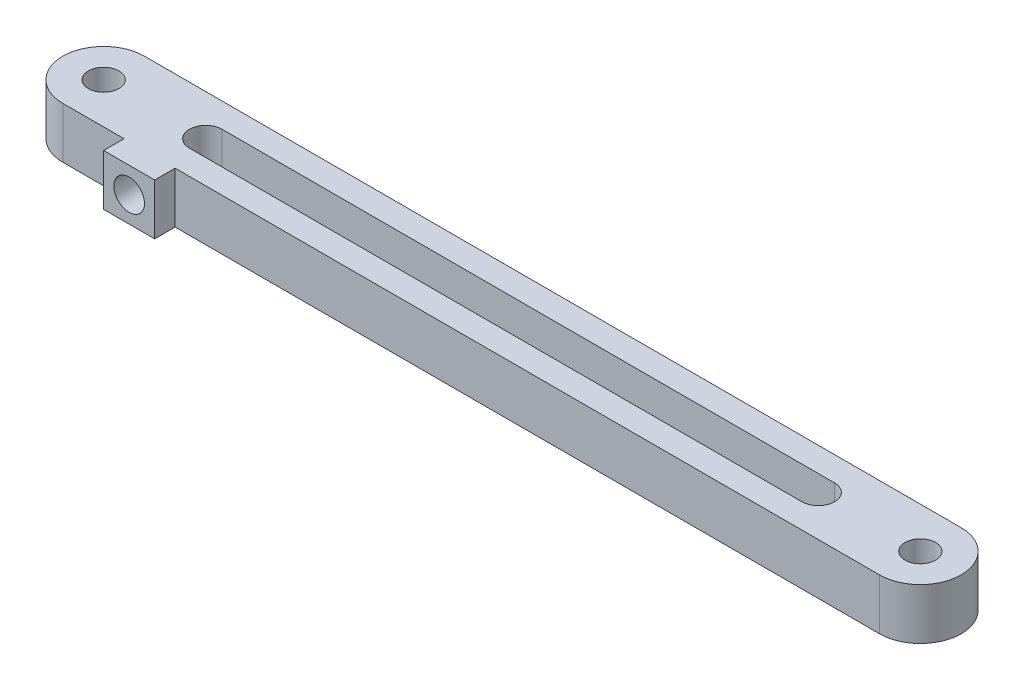
from build123d import *

# Parameters (mm, degrees)
SKETCH1_R           = 1.5
BOSS_EXTRUDE1_DEPTH = 5
SKETCH2_W           = 5
SKETCH2_H           = 5
BOSS_EXTRUDE2_DEPTH = 2
SKETCH3_R           = 1.5
CUT_EXTRUDE2_DEPTH  = 3


with BuildPart() as part:
    # Sketch1 → Boss-Extrude1 (new body)
    with BuildSketch(Plane(origin=(0, 0, 0), x_dir=(1, 0, 0), z_dir=(0, 1, 0))):
        with BuildLine():
            Line((-40, 4), (40, 4))
            ThreePointArc((40, 4), (44, 0), (40, -4))
            Line((40, -4), (-40, -4))
            ThreePointArc((-40, -4), (-44, 0), (-40, 4))
        make_face()
        with Locations((-40, 0)):
            Circle(SKETCH1_R, mode=Mode.SUBTRACT)
        with Locations((40, 0)):
            Circle(SKETCH1_R, mode=Mode.SUBTRACT)
        with BuildLine():
            Line((-30, 1.6), (30, 1.6))
            ThreePointArc((30, 1.6), (31.6, 0), (30, -1.6))
            Line((30, -1.6), (-30, -1.6))
            ThreePointArc((-30, -1.6), (-31.6, 0), (-30, 1.6))
        make_face(mode=Mode.SUBTRACT)
    extrude(amount=BOSS_EXTRUDE1_DEPTH)

    # Sketch2 → Boss-Extrude2 (add)
    with BuildSketch(Plane.XY.offset(4)):
        with Locations((-31.5, 2.5)):
            Rectangle(SKETCH2_W, SKETCH2_H)
    extrude(amount=BOSS_EXTRUDE2_DEPTH)

    # Sketch3 → Cut-Extrude2 (cut)
    with BuildSketch(Plane.XY.offset(6)):
        with Locations((-31.5, 2.5)):
            Circle(SKETCH3_R)
    extrude(amount=-CUT_EXTRUDE2_DEPTH, mode=Mode.SUBTRACT)


solid = part.part
